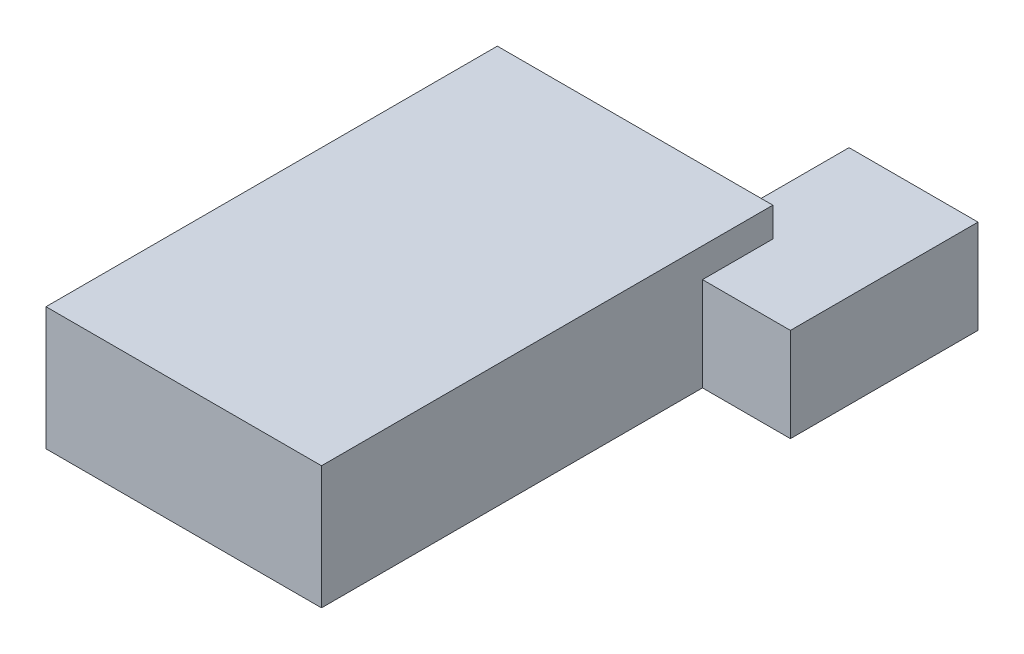
from build123d import *

# Parameters (mm, degrees)
SKETCH1_W                        = 9000
SKETCH1_H                        = 15000
BOSS_EXTRUDE1_DEPTH              = 4000
BOSS_EXTRUDE2_DEPTH              = 4000
BOSS_EXTRUDE2_DEPTH_BACK         = 2000
SKETCH2_W                        = 3000
SKETCH2_H                        = 3000
SKETCH2_W_2                      = 1000
SKETCH3_W                        = 11000
SKETCH3_H                        = 7000
BOSS_EXTRUDE3_DEPTH              = 12500
SKETCH4_W                        = 7000
SKETCH4_H                        = 4000
BOSS_EXTRUDE4_DEPTH              = 1500
SKETCH5_W                        = 10000
SKETCH5_H                        = 4000
BOSS_EXTRUDE5_DEPTH              = 12000
SKETCH6_R                        = 2000
BOSS_EXTRUDE6_DEPTH              = 6000
BOSS_EXTRUDE8_DEPTH              = 10000
BOSS_EXTRUDE8_DEPTH_BACK         = 4000
SKETCH9_R                        = 7500
REVOLVE5_ANGLE                   = 180
BOSS_EXTRUDE9_START              = 40000
BOSS_EXTRUDE9_DEPTH              = 40000
BOSS_EXTRUDE11_REACH             = 44869.165
SKETCH16_R                       = 7500
BOSS_EXTRUDE11_DIRECTION_2_DEPTH = 20000
BOSS_EXTRUDE12_DEPTH             = 10000
FILLET1_R                        = 1000
FILLET2_R                        = 1000
SKETCH19_W                       = 3000
SKETCH19_H                       = 6000
CUT_EXTRUDE1_DEPTH               = 8500
CUT_EXTRUDE2_DEPTH               = 65678.168408597
CUT_EXTRUDE2_DEPTH_BACK          = 65678.168408597
CUT_EXTRUDE5_START               = -6000
CUT_EXTRUDE5_DEPTH               = 24250
SHELL1_T                         = 200
SKETCH23_W                       = 1000
SKETCH23_H                       = 200
SKETCH23_W_2                     = 200
SKETCH23_H_2                     = 800
BOSS_EXTRUDE13_DEPTH             = 3000
SKETCH24_W                       = 1000
SKETCH24_H                       = 700
BOSS_EXTRUDE14_DEPTH             = 200


# Read off the part's stored shape, not the designer's step: Cut-Extrude5
with BuildPart() as part:
    # Sketch1 → Boss-Extrude1 (new body)
    with BuildSketch(Plane(origin=(0, 0, 0), x_dir=(1, 0, 0), z_dir=(0, 1, 0))):
        Rectangle(SKETCH1_W, SKETCH1_H)
    extrude(amount=BOSS_EXTRUDE1_DEPTH)

    # Sketch2 → Boss-Extrude2 (add, two sides: drawn at the far end of the back side and taken through both)
    with BuildSketch(Plane(origin=(0, 0, -7500), x_dir=(-1, 0, 0), z_dir=(0, 0, -1)).offset(-BOSS_EXTRUDE2_DEPTH_BACK)):
        with Locations((-6000, 1500)):
            Rectangle(SKETCH2_W, SKETCH2_H)
        with Locations((-4000, 1500)):
            Rectangle(SKETCH2_W_2, SKETCH2_H)
    extrude(amount=BOSS_EXTRUDE2_DEPTH + BOSS_EXTRUDE2_DEPTH_BACK)

    # Sketch3 → Boss-Extrude3 (add)
    with BuildSketch(Plane.XZ):
        with Locations((5000, -8000)):
            Rectangle(SKETCH3_W, SKETCH3_H)
    extrude(amount=BOSS_EXTRUDE3_DEPTH)

    # Sketch4 → Boss-Extrude4 (add)
    with BuildSketch(Plane.XZ.offset(12500)):
        with Locations((7000, -9500)):
            Rectangle(SKETCH4_W, SKETCH4_H)
    extrude(amount=BOSS_EXTRUDE4_DEPTH)

    # Sketch5 → Boss-Extrude5 (add)
    with BuildSketch(Plane.XY.offset(-4500)):
        with Locations((4500, -10500)):
            Rectangle(SKETCH5_W, SKETCH5_H)
    extrude(amount=BOSS_EXTRUDE5_DEPTH)

    # Sketch6 → Boss-Extrude6 (add)
    with BuildSketch(Plane(origin=(9500, 0, 0), x_dir=(0, 0, -1), z_dir=(1, 0, 0))):
        with Locations(Location((-5250, -11500, 0), (0, 0, 210))):
            Circle(SKETCH6_R)
    extrude(amount=BOSS_EXTRUDE6_DEPTH)

    # Sketch9 → Boss-Extrude8 (add, two sides: drawn at the far end of the back side and taken through both)
    with BuildSketch(Plane(origin=(0, -10500, 0), x_dir=(-1, 0, 0), z_dir=(0, -1, 0)).offset(-BOSS_EXTRUDE8_DEPTH_BACK)):
        with Locations(Location((-22728.4161474, -5250, 0), (0, 0, 90))):
            Circle(SKETCH9_R)
    extrude(amount=BOSS_EXTRUDE8_DEPTH + BOSS_EXTRUDE8_DEPTH_BACK)

    # Sketch10 → Revolve5 (revolve)
    with BuildSketch(Plane(origin=(0, -6500, 0), x_dir=(1, 0, 0), z_dir=(0, 1, 0))):
        with BuildLine():
            Line((15228.4161474, -5250), (30228.4161474, -5250))
            ThreePointArc((30228.4161474, -5250), (22728.4161474, 2250), (15228.4161474, -5250))
        make_face()
    revolve(axis=Axis((15228.4161474, -6500, 5250), (1, 0, 0)), revolution_arc=REVOLVE5_ANGLE)

    # Sketch12 → Boss-Extrude9 (add)
    with BuildSketch(Plane.ZY.offset(500).offset(BOSS_EXTRUDE9_START)):
        with BuildLine():
            ThreePointArc((3517.949192431, -12500), (5250, -13500), (6982.050807569, -12500))
            ThreePointArc((6982.050807569, -12500), (5250, -9500), (3517.949192431, -12500))
        make_face()
    extrude(amount=-BOSS_EXTRUDE9_DEPTH)

    # Boss-Extrude11: up to this face of the body (flat: up to its plane)
    boss_extrude11_end = Plane(part.part.faces().sort_by_distance((-250, 0, 750))[0])
    # Sketch16 → Boss-Extrude11 (add, up to the picked face)
    with BuildSketch(Plane(origin=(0, -10500, 0), x_dir=(-1, 0, 0), z_dir=(0, -1, 0)), mode=Mode.PRIVATE) as boss_extrude11_sk1:
        with Locations(Location((47728.4161474, -5250, 0), (0, 0, 90))):
            Circle(SKETCH16_R)
    boss_extrude11_tool1 = split(extrude(boss_extrude11_sk1.sketch, amount=-BOSS_EXTRUDE11_REACH, mode=Mode.PRIVATE), bisect_by=boss_extrude11_end, keep=Keep.BOTH, mode=Mode.PRIVATE)
    add(boss_extrude11_tool1.solids().sort_by(Axis((-47728.416147, -10500, 5250), (0, 1, 0)))[0])

    # Sketch16 → Boss-Extrude11 direction 2 (add)
    with BuildSketch(Plane(origin=(0, -10500, 0), x_dir=(-1, 0, 0), z_dir=(0, -1, 0))):
        with Locations(Location((47728.4161474, -5250, 0), (0, 0, 90))):
            Circle(SKETCH16_R)
    extrude(amount=BOSS_EXTRUDE11_DIRECTION_2_DEPTH)

    # Sketch18 → Boss-Extrude12 (add)
    with BuildSketch(Plane(origin=(-500, 0, 0), x_dir=(0, 0, -1), z_dir=(1, 0, 0))):
        with BuildLine():
            Line((-3517.949192431, -12500), (-6982.050807569, -12500))
            ThreePointArc((-6982.050807569, -12500), (-5250, -13500), (-3517.949192431, -12500))
        make_face()
    extrude(amount=BOSS_EXTRUDE12_DEPTH)

    # Fillet1
    fillet1_edges = [part.edges().sort_by_distance(p)[0] for p in [
        (22728.4161474, -20500, 12750),
    ]]
    fillet(fillet1_edges, radius=FILLET1_R)

    # Fillet2
    fillet2_edges = [part.edges().sort_by_distance(p)[0] for p in [
        (-47728.4161474, -30500, 12750),
    ]]
    fillet(fillet2_edges, radius=FILLET2_R)

    # Sketch19 → Cut-Extrude1 (cut)
    with BuildSketch(Plane(origin=(0, 0, 0), x_dir=(1, 0, 0), z_dir=(0, 1, 0))):
        with Locations((9000, 8500)):
            Rectangle(SKETCH19_W, SKETCH19_H)
    extrude(amount=-CUT_EXTRUDE1_DEPTH, mode=Mode.SUBTRACT)

    # Sketch20 → Cut-Extrude2 (cut, two sides: drawn at the far end of the back side and taken through both)
    with BuildSketch(Plane(origin=(0, 0, -5500), x_dir=(-1, 0, 0), z_dir=(0, 0, -1)).offset(-CUT_EXTRUDE2_DEPTH_BACK)):
        Polygon((-10500, 0), (-10500, -8500), (-7500, -7500), (-7500, 0), align=None)
    extrude(amount=CUT_EXTRUDE2_DEPTH + CUT_EXTRUDE2_DEPTH_BACK, mode=Mode.SUBTRACT)

    # Cut-Extrude5 outline → Cut-Extrude5 (cut)
    with BuildSketch(Plane.XY.offset(-5500).offset(CUT_EXTRUDE5_START)):
        Polygon((-500, 0), (-500, -4833.333333333), (-15000, 0), (-55230, 0), (-55230, -30500), (30230, -30500), (30230, 1001), (7500, 1001), (7500, 0), align=None)
    extrude(amount=CUT_EXTRUDE5_DEPTH, mode=Mode.SUBTRACT)

    # Shell1
    shell1_openings = [part.faces().sort_by_distance(p)[0] for p in [
        (789.808917197, 0, -1216.560509554),
    ]]
    offset(amount=SHELL1_T, openings=shell1_openings, kind=Kind.INTERSECTION)

    # Sketch23 → Boss-Extrude13 (add)
    with BuildSketch(Plane.XZ.offset(-3000)):
        Polygon((4500, -7300), (4500, -7500), (4500, -7700), (4700, -7700), (4700, -7300), align=None)
        with Locations((4000, -7600)):
            Rectangle(SKETCH23_W, SKETCH23_H)
        with Locations((4600, -5900)):
            Rectangle(SKETCH23_W_2, SKETCH23_H_2)
    extrude(amount=BOSS_EXTRUDE13_DEPTH)

    # Sketch24 → Boss-Extrude14 (add)
    with BuildSketch(Plane.ZY.offset(-4500)):
        with Locations((-6800, 2650)):
            Rectangle(SKETCH24_W, SKETCH24_H)
    extrude(amount=-BOSS_EXTRUDE14_DEPTH)


solid = part.part
